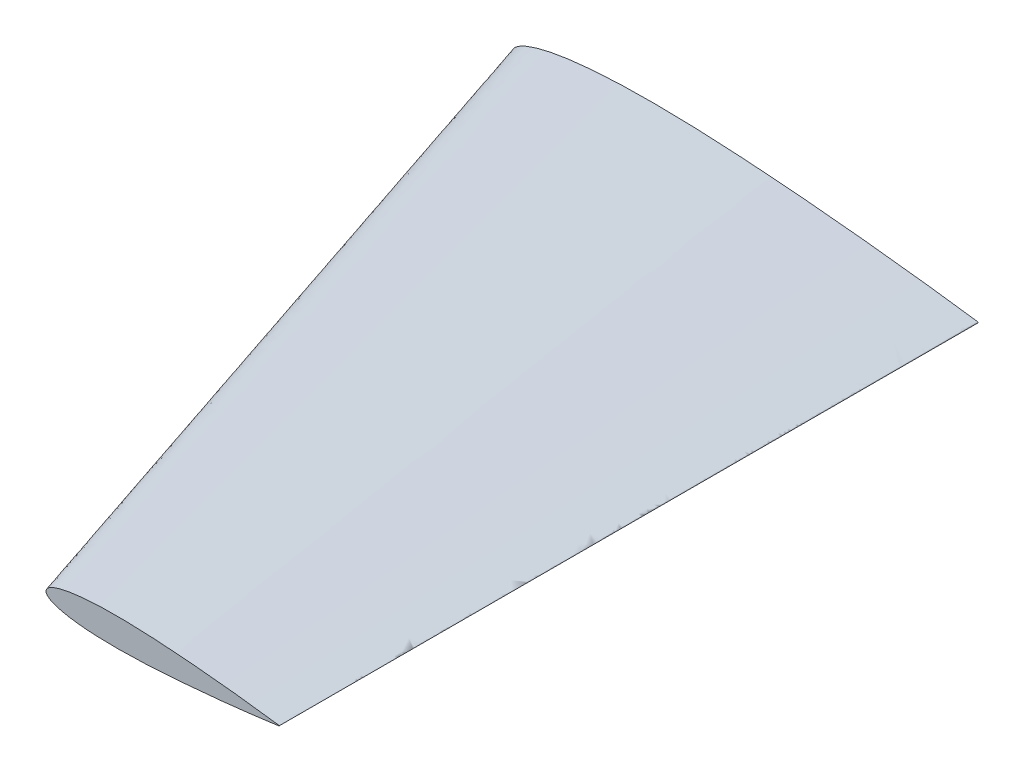
from build123d import *

# Parameters (mm, degrees)
SKETCH4_R          = 3.175
CUT_EXTRUDE3_DEPTH = 40


with BuildPart() as part:
    # Sketch2 for Loft3 → Loft3 section 0
    with BuildSketch(Plane(origin=(0, 0, 0), x_dir=(0, 1, 0), z_dir=(0, 0, 1))):
        with BuildLine():
            # circular arc as an exact rational Bezier (weights 1, cos(half-angle), 1)
            Bezier((-0.1134, -90), (0, -90.808630182), (0.1134, -90), weights=[1, 0.138878188, 1])
            add(Edge.make_bspline(
                [(0.1134, -90), (0.119883103, -89.953770434), (0.145780197, -89.769104014), (0.203559317, -89.354670505), (0.29903625, -88.666808737), (0.43002961, -87.709721874), (0.595034667, -86.48935693), (0.790717945, -85.013174411), (1.014447537, -83.290291495), (1.262704812, -81.331354624), (1.532156619, -79.148419388), (1.81883068, -76.754947135), (2.119272922, -74.165710303), (2.429361956, -71.396635047), (2.745321108, -68.464808853), (3.063223397, -65.388326514), (3.378966278, -62.186148552), (3.688117442, -58.878026055), (3.986618437, -55.484331913), (4.269478842, -52.026026469), (4.532086612, -48.524359499), (4.769566223, -45.000951756), (4.976952181, -41.477512363), (5.149005142, -37.975732412), (5.281137154, -34.517238785), (5.369037574, -31.123254472), (5.408413012, -27.814753604), (5.396138618, -24.61206555), (5.329843493, -21.534935718), (5.207847127, -18.602305244), (5.029830398, -15.832225033), (4.796328946, -13.241720098), (4.509166427, -10.846642485), (4.17078617, -8.66159096), (3.784722266, -6.699806407), (3.355340044, -4.972787114), (2.886826516, -3.490346755), (2.383545234, -2.260017099), (1.848901134, -1.285721701), (1.281838991, -0.568959771), (0.668640285, -0.109879586), (0, 0.051207794), (-0.668640285, -0.109879586), (-1.281838991, -0.568959771), (-1.848901134, -1.285721701), (-2.383545234, -2.260017099), (-2.886826516, -3.490346755), (-3.355340044, -4.972787114), (-3.784722266, -6.699806407), (-4.17078617, -8.66159096), (-4.509166427, -10.846642485), (-4.796328946, -13.241720098), (-5.029830398, -15.832225033), (-5.207847127, -18.602305244), (-5.329843493, -21.534935718), (-5.396138618, -24.61206555), (-5.408413012, -27.814753604), (-5.369037574, -31.123254472), (-5.281137154, -34.517238785), (-5.149005142, -37.975732412), (-4.976952181, -41.477512363), (-4.769566223, -45.000951756), (-4.532086612, -48.524359499), (-4.269478842, -52.026026469), (-3.986618437, -55.484331913), (-3.688117442, -58.878026055), (-3.378966278, -62.186148552), (-3.063223397, -65.388326514), (-2.745321108, -68.464808853), (-2.429361956, -71.396635047), (-2.119272922, -74.165710303), (-1.81883068, -76.754947135), (-1.532156619, -79.148419388), (-1.262704812, -81.331354624), (-1.014447537, -83.290291495), (-0.790717945, -85.013174411), (-0.595034667, -86.48935693), (-0.43002961, -87.709721874), (-0.29903625, -88.666808737), (-0.203559317, -89.354670505), (-0.145780197, -89.769104014), (-0.119883103, -89.953770434), (-0.1134, -90)],
                knots=[0, 0, 0, 0, 0.000763157, 0.003048469, 0.00684069, 0.012116132, 0.018840792, 0.02697275, 0.036459854, 0.047242945, 0.059253555, 0.072417264, 0.086651022, 0.101866322, 0.117968955, 0.134857919, 0.152428309, 0.170571841, 0.189174522, 0.208122338, 0.227296649, 0.24658007, 0.265853108, 0.284996761, 0.303895242, 0.322432581, 0.340498659, 0.357984483, 0.374788114, 0.390812303, 0.405965006, 0.420162443, 0.433328265, 0.445393603, 0.456301171, 0.466003881, 0.474472001, 0.481696232, 0.487703698, 0.492583405, 0.496543603, 0.5, 0.503456397, 0.507416595, 0.512296302, 0.518303768, 0.525527999, 0.533996119, 0.543698829, 0.554606397, 0.566671735, 0.579837557, 0.594034994, 0.609187697, 0.625211886, 0.642015517, 0.659501341, 0.677567419, 0.696104758, 0.715003239, 0.734146892, 0.75341993, 0.772703351, 0.791877662, 0.810825478, 0.829428159, 0.847571691, 0.865142081, 0.882031045, 0.898133678, 0.913348978, 0.927582736, 0.940746445, 0.952757055, 0.963540146, 0.97302725, 0.981159208, 0.987883868, 0.99315931, 0.996951531, 0.999236843, 1, 1, 1, 1], degree=3))
        make_face()
    # Sketch3 for Loft3 → Loft3 section 1
    with BuildSketch(Plane(origin=(0, 0, 135), x_dir=(0, 1, 0), z_dir=(0, 0, 1))):
        with BuildLine():
            Bezier((-0.056699778, -89.992021071), (2.22e-07, -90.396115682), (0.056700222, -89.992021071), weights=[1, 0.138952499, 1])
            add(Edge.make_bspline(
                [(0.056700222, -89.992021071), (0.057929131, -89.983262772), (0.062841784, -89.948250844), (0.073857926, -89.86955012), (0.11637667, -89.565202972), (0.170221742, -89.175070863), (0.23489848, -88.700044612), (0.286840547, -88.314766782), (0.344710825, -87.880857243), (0.408144013, -87.39932848), (0.476798153, -86.871306933), (0.550250676, -86.298021737), (0.628128349, -85.680815135), (0.709991994, -85.02112649), (0.860104983, -83.790183664), (1.011762689, -82.496350502), (1.164056147, -81.142664585), (1.295010817, -79.951405991), (1.425277125, -78.721632589), (1.58813417, -77.120712895), (1.750959211, -75.446415639), (1.905812393, -73.74062365), (2.055695106, -71.985134561), (2.169242669, -70.558099527), (2.274157056, -69.120715662), (2.348228614, -68.03546329), (2.416853381, -66.948939547), (2.479450529, -65.863682388), (2.535434654, -64.782225098), (2.584246521, -63.707092455), (2.625328304, -62.640793985), (2.658153173, -61.585820613), (2.682241615, -60.54463621), (2.697134404, -59.519670049), (2.702430281, -58.513315089), (2.697781196, -57.527921577), (2.682910809, -56.565790484), (2.657587018, -55.62916672), (2.621671529, -54.720236128), (2.575098706, -53.841120782), (2.51785763, -52.993873119), (2.450042549, -52.180467453), (2.371815381, -51.402798205), (2.283386068, -50.662680118), (2.185077568, -49.96183187), (2.077217243, -49.301884359), (1.960252764, -48.684360004), (1.834602473, -48.110687459), (1.700788426, -47.582171423), (1.559293811, -47.100011992), (1.410653102, -46.665269814), (1.255362702, -46.278872935), (1.093885707, -45.941587758), (0.926587925, -45.654012713), (0.753660163, -45.416568438), (0.574935411, -45.229602037), (0.389788396, -45.0937157), (0.197413726, -45.010562163), (2.22e-07, -44.982982808), (-0.197413282, -45.010562163), (-0.389787951, -45.0937157), (-0.574934967, -45.229602037), (-0.753659719, -45.416568438), (-0.926587481, -45.654012713), (-1.093885263, -45.941587758), (-1.255362257, -46.278872935), (-1.410652657, -46.665269814), (-1.559293366, -47.100011992), (-1.700787981, -47.582171423), (-1.834602028, -48.110687459), (-1.960252319, -48.684360004), (-2.077216799, -49.301884359), (-2.185077124, -49.96183187), (-2.283385623, -50.662680118), (-2.371814937, -51.402798205), (-2.450042105, -52.180467453), (-2.517857186, -52.993873119), (-2.575098262, -53.841120782), (-2.621671085, -54.720236128), (-2.657586574, -55.62916672), (-2.682910365, -56.565790484), (-2.697780752, -57.527921577), (-2.702429837, -58.513315089), (-2.69713396, -59.519670049), (-2.68224117, -60.54463621), (-2.658152729, -61.585820613), (-2.625327859, -62.640793985), (-2.584246076, -63.707092455), (-2.53543421, -64.782225098), (-2.479450084, -65.863682388), (-2.416852937, -66.948939547), (-2.34822817, -68.03546329), (-2.274156611, -69.120715662), (-2.169242224, -70.558099527), (-2.055694662, -71.985134561), (-1.905811949, -73.74062365), (-1.750957249, -75.446415564), (-1.557728162, -77.433370147), (-1.392620721, -79.034064017), (-1.260684837, -80.263655946), (-1.164055702, -81.142664585), (-1.039555221, -82.249307973), (-0.916451005, -83.309411724), (-0.795432776, -84.320499142), (-0.709991549, -85.02112649), (-0.628127904, -85.680815135), (-0.550250231, -86.298021737), (-0.476797708, -86.871306933), (-0.408143568, -87.39932848), (-0.344710381, -87.880857243), (-0.286840103, -88.314766782), (-0.211507364, -88.873543807), (-0.146391138, -89.348510505), (-0.092153525, -89.738587912), (-0.073857482, -89.86955012), (-0.062841339, -89.948250844), (-0.057928687, -89.983262772), (-0.056699778, -89.992021071)],
                knots=[0, 0, 0, 0, 0.000289141, 0.001155863, 0.002598059, 0.01033584, 0.014031408, 0.018271448, 0.023045738, 0.028342883, 0.034150143, 0.040453725, 0.047238587, 0.054488555, 0.062186439, 0.087780098, 0.097077367, 0.106721847, 0.12696067, 0.137507311, 0.159331006, 0.181956682, 0.193504005, 0.216932154, 0.228757987, 0.240621466, 0.252494881, 0.264350492, 0.276160727, 0.287898253, 0.299535921, 0.311046954, 0.322405012, 0.333584242, 0.344559423, 0.355305878, 0.365799648, 0.376017629, 0.385937517, 0.395537817, 0.40479805, 0.413698804, 0.422221685, 0.430349463, 0.438066154, 0.445357163, 0.452209429, 0.458611487, 0.464554011, 0.470029939, 0.475035079, 0.479569173, 0.483636923, 0.487250229, 0.4904315, 0.493218854, 0.495674077, 0.497891234, 0.5, 0.502108766, 0.504325923, 0.506781146, 0.5095685, 0.512749771, 0.516363077, 0.520430827, 0.524964921, 0.529970061, 0.535445989, 0.541388513, 0.547790571, 0.554642837, 0.561933846, 0.569650537, 0.577778315, 0.586301196, 0.59520195, 0.604462183, 0.614062483, 0.623982371, 0.634200352, 0.644694122, 0.655440577, 0.666415758, 0.677594988, 0.688953046, 0.700464079, 0.712101747, 0.723839273, 0.735649508, 0.747505119, 0.759378534, 0.771242013, 0.783067846, 0.806495995, 0.818043318, 0.840668994, 0.862492689, 0.883309251, 0.893278153, 0.902922633, 0.912219902, 0.929686019, 0.937813561, 0.945511445, 0.952761413, 0.959546275, 0.965849857, 0.971657117, 0.976954262, 0.981728552, 0.985968592, 0.99538771, 0.997401941, 0.998844137, 0.999710859, 1, 1, 1, 1], degree=3))
        make_face()
    loft()

    # Sketch4 → Cut-Extrude3 (cut)
    with BuildSketch(Plane(origin=(0, 0, 0), x_dir=(1, 0, 0), z_dir=(0, 0, -1))):
        with Locations((39.984097106, 0)):
            Circle(SKETCH4_R)
    extrude(amount=-CUT_EXTRUDE3_DEPTH, mode=Mode.SUBTRACT)


solid = part.part
